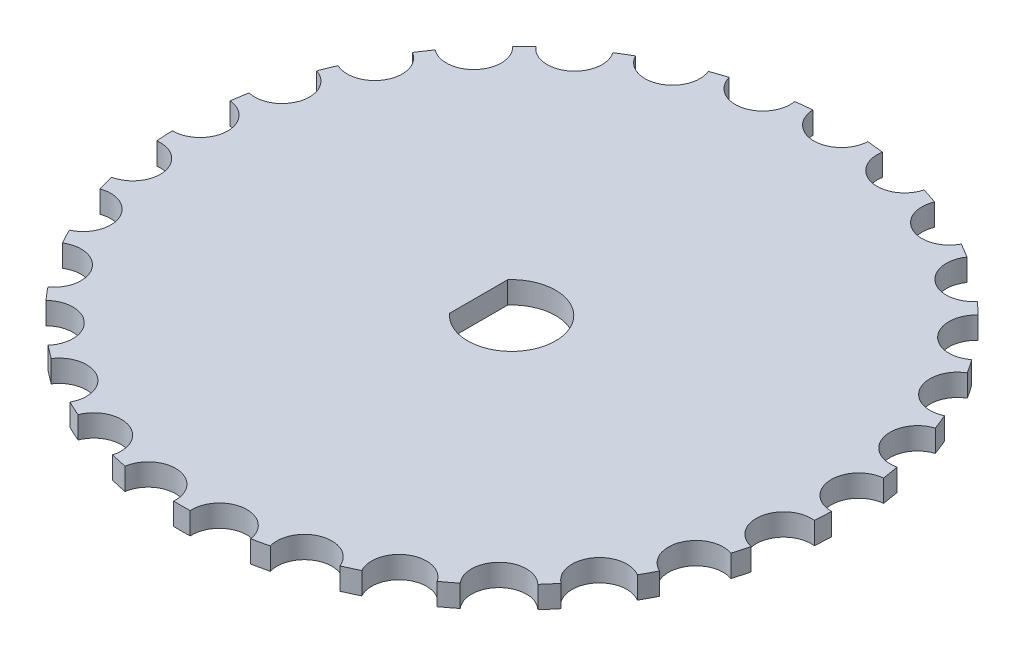
from build123d import *

# Parameters (mm, degrees)
SKETCH1_R           = 30
BOSS_EXTRUDE1_DEPTH = 2
CUT_EXTRUDE2_DEPTH  = 43.473521163
SKETCH2_R           = 2.5
CUT_EXTRUDE1_DEPTH  = 43.473521163


with BuildPart() as part:
    # Sketch1 → Boss-Extrude1 (new body)
    with BuildSketch(Plane(origin=(0, 0, 0), x_dir=(1, 0, 0), z_dir=(0, 1, 0))):
        Circle(SKETCH1_R)
    extrude(amount=BOSS_EXTRUDE1_DEPTH)

    # Sketch4 → Cut-Extrude2 (cut, through all)
    with BuildSketch(Plane(origin=(0, 2, 0), x_dir=(1, 0, 0), z_dir=(0, 1, 0))):
        with BuildLine():
            Line((-3, -2.645751311), (-3, 2.645751311))
            ThreePointArc((-3, 2.645751311), (4, 0), (-3, -2.645751311))
        make_face()
    extrude(amount=-CUT_EXTRUDE2_DEPTH, mode=Mode.SUBTRACT)

    # Sketch2 → Cut-Extrude1 (cut, through all)
    with BuildSketch(Plane(origin=(0, 2, 0), x_dir=(1, 0, 0), z_dir=(0, 1, 0))):
        with Locations((0, 30)):
            Circle(SKETCH2_R)
        with Locations((6.449113206, 29.298616671)):
            Circle(SKETCH2_R)
        with Locations((12.596673047, 27.22726259)):
            Circle(SKETCH2_R)
        with Locations((18.155226456, 23.882791971)):
            Circle(SKETCH2_R)
        with Locations((22.864861654, 19.421588543)):
            Circle(SKETCH2_R)
        with Locations((26.505361333, 14.052253221)):
            Circle(SKETCH2_R)
        with Locations((28.906499776, 8.025850156)):
            Circle(SKETCH2_R)
        with Locations((29.956002416, 1.624167258)):
            Circle(SKETCH2_R)
        with Locations((29.604795676, -4.853459897)):
            Circle(SKETCH2_R)
        with Locations((27.869301595, -11.10414466)):
            Circle(SKETCH2_R)
        with Locations((24.830669945, -16.835611961)):
            Circle(SKETCH2_R)
        with Locations((20.630983766, -21.779864758)):
            Circle(SKETCH2_R)
        with Locations((15.466615715, -25.705715285)):
            Circle(SKETCH2_R)
        with Locations((9.579045904, -28.429595135)):
            Circle(SKETCH2_R)
        with Locations((3.243570553, -29.824138715)):
            Circle(SKETCH2_R)
        with Locations((-3.243570553, -29.824138715)):
            Circle(SKETCH2_R)
        with Locations((-9.579045904, -28.429595135)):
            Circle(SKETCH2_R)
        with Locations((-15.466615715, -25.705715285)):
            Circle(SKETCH2_R)
        with Locations((-20.630983766, -21.779864758)):
            Circle(SKETCH2_R)
        with Locations((-24.830669945, -16.835611961)):
            Circle(SKETCH2_R)
        with Locations((-27.869301595, -11.10414466)):
            Circle(SKETCH2_R)
        with Locations((-29.604795676, -4.853459897)):
            Circle(SKETCH2_R)
        with Locations((-29.956002416, 1.624167258)):
            Circle(SKETCH2_R)
        with Locations((-28.906499776, 8.025850156)):
            Circle(SKETCH2_R)
        with Locations((-26.505361333, 14.052253221)):
            Circle(SKETCH2_R)
        with Locations((-22.864861654, 19.421588543)):
            Circle(SKETCH2_R)
        with Locations((-18.155226456, 23.882791971)):
            Circle(SKETCH2_R)
        with Locations((-12.596673047, 27.22726259)):
            Circle(SKETCH2_R)
        with Locations((-6.449113206, 29.298616671)):
            Circle(SKETCH2_R)
    extrude(amount=-CUT_EXTRUDE1_DEPTH, mode=Mode.SUBTRACT)


solid = part.part
